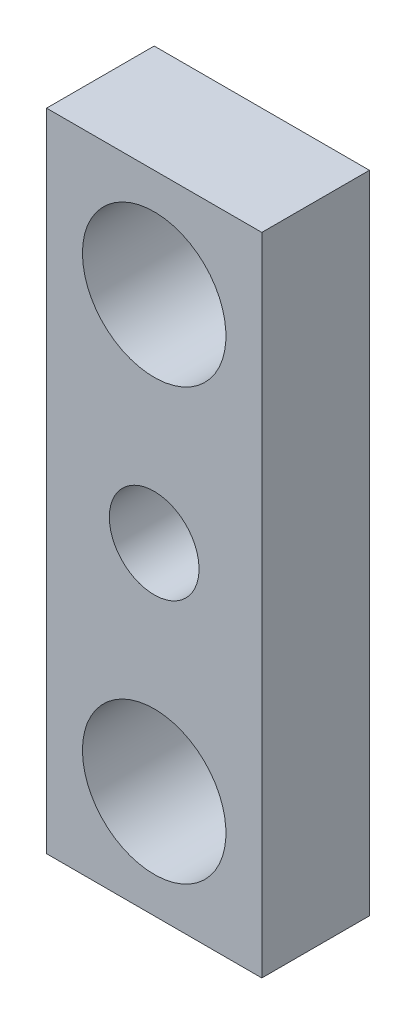
from build123d import *

# Parameters (mm, degrees)
SKETCH1_W           = 19.05
SKETCH1_H           = 57.15
SKETCH1_R           = 3.96875
SKETCH1_R_2         = 6.35
BOSS_EXTRUDE2_DEPTH = 9.525


with BuildPart() as part:
    # Sketch1 → Boss-Extrude2 (new body)
    with BuildSketch(Plane.XY):
        with Locations((0, -200.025)):
            Rectangle(SKETCH1_W, SKETCH1_H)
        with Locations((0, -200.025)):
            Circle(SKETCH1_R, mode=Mode.SUBTRACT)
        with Locations((0, -180.975)):
            Circle(SKETCH1_R_2, mode=Mode.SUBTRACT)
        with Locations((0, -219.075)):
            Circle(SKETCH1_R_2, mode=Mode.SUBTRACT)
    extrude(amount=BOSS_EXTRUDE2_DEPTH)


solid = part.part
